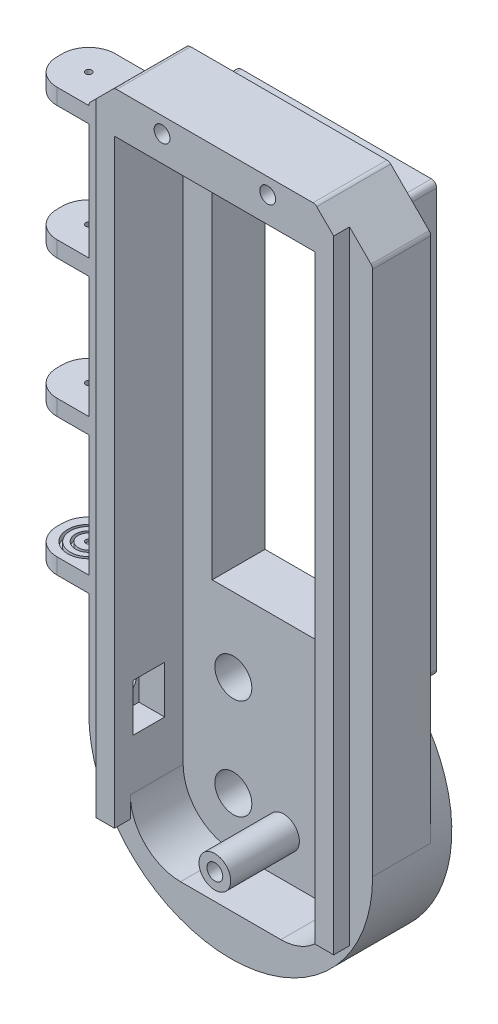
from build123d import *
from build123d.topology import SkipClean

# Parameters (mm, degrees)
CROQUIS1_W               = 27
CROQUIS1_H               = 72
CROQUIS1_R               = 3.5
SALIENTE_EXTRUIR1_DEPTH  = 5
CROQUIS2_W               = 38
CROQUIS2_H               = 81
CROQUIS2_W_2             = 27
CROQUIS2_H_2             = 72
SALIENTE_EXTRUIR2_DEPTH  = 5
SALIENTE_EXTRUIR9_START  = -1
SALIENTE_EXTRUIR9_DEPTH  = 1
SALIENTE_EXTRUIR10_DEPTH = 11
SALIENTE_EXTRUIR11_DEPTH = 10
REDONDEO1_R              = 1
REDONDEO2_R              = 1
REDONDEO3_R              = 1
CROQUIS6_W               = 6
CROQUIS6_H               = 9
CORTAR_EXTRUIR1_DEPTH    = 8
CROQUIS7_W               = 6
CROQUIS7_H               = 9
CROQUIS7_R               = 2.5
SALIENTE_EXTRUIR12_DEPTH = 3
CROQUIS8_W               = 11
CROQUIS8_H               = 3
SALIENTE_EXTRUIR13_DEPTH = 11
REDONDEO4_R              = 5
CROQUIS9_R               = 0.6
CORTAR_EXTRUIR2_DEPTH    = 80
SALIENTE_EXTRUIR14_START = -2.5
CROQUIS10_R              = 0.6
SALIENTE_EXTRUIR14_DEPTH = 2.5
CROQUIS11_R              = 4
CROQUIS11_R_2            = 3.5
CROQUIS11_R_3            = 2.5
CROQUIS11_R_4            = 2
CORTAR_EXTRUIR3_DEPTH    = 1
SALIENTE_EXTRUIR15_DEPTH = 3
CROQUIS14_R              = 1.5
CORTAR_EXTRUIR4_DEPTH    = 14
CROQUIS16_W              = 3.5
CROQUIS16_H              = 3
SALIENTE_EXTRUIR16_DEPTH = 4
SALIENTE_EXTRUIR21_DEPTH = 18
CROQUIS26_R              = 1.5
CORTAR_EXTRUIR7_DEPTH    = 18


with BuildPart() as part:
    # Croquis1 → Saliente-Extruir1 (new body)
    with BuildSketch(Plane.XY):
        with BuildLine():
            Line((-19, 40.5), (-19, -40.5))
            ThreePointArc((-19, -40.5), (0, -86.370057685), (19, -40.5))
            Line((19, -40.5), (19, 40.5))
            Line((19, 40.5), (-19, 40.5))
        make_face()
        Rectangle(CROQUIS1_W, CROQUIS1_H, mode=Mode.SUBTRACT)
        with Locations((9.5, -59.5)):
            Circle(CROQUIS1_R, mode=Mode.SUBTRACT)
        with Locations((-9.5, -69)):
            Circle(CROQUIS1_R, mode=Mode.SUBTRACT)
        with Locations((-9.5, -50)):
            Circle(CROQUIS1_R, mode=Mode.SUBTRACT)
    extrude(amount=SALIENTE_EXTRUIR1_DEPTH)

    # Croquis2 → Saliente-Extruir2 (add)
    with BuildSketch(Plane(origin=(0, 0, 0), x_dir=(-1, 0, 0), z_dir=(0, 0, -1))):
        Rectangle(CROQUIS2_W, CROQUIS2_H)
        Rectangle(CROQUIS2_W_2, CROQUIS2_H_2, mode=Mode.SUBTRACT)
    extrude(amount=SALIENTE_EXTRUIR2_DEPTH)

    # Croquis3 → Saliente-Extruir9 (add)
    with BuildSketch(Plane.XY.offset(5).offset(SALIENTE_EXTRUIR9_START)):
        with BuildLine():
            Line((26.870057685, -59.5), (26.870057685, 40.5))
            Line((26.870057685, 40.5), (19, 48.370057685))
            Line((19, 48.370057685), (-19, 48.370057685))
            Line((-19, 48.370057685), (-26.870057685, 40.5))
            Line((-26.870057685, 40.5), (-26.870057685, -59.5))
            ThreePointArc((-26.870057685, -59.5), (0, -86.370057685), (26.870057685, -59.5))
        make_face()
        with BuildLine():
            Line((19, -59.5), (19, 40.5))
            Line((19, 40.5), (-19, 40.5))
            Line((-19, 40.5), (-19, -59.5))
            ThreePointArc((-19, -59.5), (0, -78.5), (19, -59.5))
        make_face(mode=Mode.SUBTRACT)
    extrude(amount=SALIENTE_EXTRUIR9_DEPTH)

    # Croquis4 → Saliente-Extruir10 (add)
    with BuildSketch(Plane(origin=(0, 0, 4), x_dir=(-1, 0, 0), z_dir=(0, 0, -1))):
        with BuildLine():
            Line((-19, -40.5), (-19, 40.5))
            Line((-19, 40.5), (19, 40.5))
            Line((19, 40.5), (19, -40.5))
            ThreePointArc((19, -40.5), (24.824696333, -49.217274097), (26.870057685, -59.5))
            Line((26.870057685, -59.5), (26.870057685, 40.5))
            Line((26.870057685, 40.5), (19, 48.370057685))
            Line((19, 48.370057685), (-19, 48.370057685))
            Line((-19, 48.370057685), (-26.870057685, 40.5))
            Line((-26.870057685, 40.5), (-26.870057685, -59.5))
            ThreePointArc((-26.870057685, -59.5), (-24.824696333, -49.217274097), (-19, -40.5))
        make_face()
    extrude(amount=-SALIENTE_EXTRUIR10_DEPTH)

    # Croquis5 → Saliente-Extruir11 (add)
    with SkipClean():  # the faces are left unmerged after this step: merging them gives an invalid solid
        with BuildSketch(Plane.XY.offset(5)):
            with BuildLine():
                Line((-19, -59.5), (-19, -69))
                ThreePointArc((-19, -69), (-16.217514421, -75.717514421), (-9.5, -78.5))
                Line((-9.5, -78.5), (9.5, -78.5))
                ThreePointArc((9.5, -78.5), (16.217514421, -75.717514421), (19, -69))
                Line((19, -69), (19, -59.5))
                Line((19, -59.5), (19, -40.5))
                ThreePointArc((19, -40.5), (0, -86.370057685), (-19, -40.5))
                Line((-19, -40.5), (-19, -59.5))
            make_face()
        extrude(amount=SALIENTE_EXTRUIR11_DEPTH)

    # Redondeo1
    redondeo1_edges = [part.edges().sort_by_distance(p)[0] for p in [
        (-19, -40.5, -2.5),
        (-19, 40.5, -0.5),
        (19, 40.5, -0.5),
        (19, -40.5, -2.5),
    ]]
    fillet(redondeo1_edges, radius=REDONDEO1_R)

    # Redondeo2
    redondeo2_edges = [part.edges().sort_by_distance(p)[0] for p in [
        (-18.707106781, 40.207106781, 4),
        (18.707106781, 40.207106781, 4),
        (-19, -0.5, 4),
        (0, 40.5, 4),
        (19, -0.5, 4),
    ]]
    fillet(redondeo2_edges, radius=REDONDEO2_R)

    # Redondeo3
    redondeo3_edges = [part.edges().sort_by_distance(p)[0] for p in [
        (-26.870057685, 40.5, 9.5),
        (-19, 48.370057685, 9.5),
        (26.870057685, 40.5, 9.5),
        (19, 48.370057685, 9.5),
    ]]
    fillet(redondeo3_edges, radius=REDONDEO3_R)

    # Croquis6 → Cortar-Extruir1 (cut)
    with SkipClean():  # the faces are left unmerged after this step: merging them gives an invalid solid
        with BuildSketch(Plane.ZY.offset(26.870057685)):
            with Locations((11.5, -55)):
                Rectangle(CROQUIS6_W, CROQUIS6_H)
        extrude(amount=-CORTAR_EXTRUIR1_DEPTH, mode=Mode.SUBTRACT)

    # Croquis7 → Saliente-Extruir12 (add)
    with SkipClean():  # the faces are left unmerged after this step: merging them gives an invalid solid
        with BuildSketch(Plane.ZY.offset(26.870057685)):
            with Locations((11.5, -55)):
                Rectangle(CROQUIS7_W, CROQUIS7_H)
            with Locations((11.5, -55)):
                Circle(CROQUIS7_R, mode=Mode.SUBTRACT)
        extrude(amount=-SALIENTE_EXTRUIR12_DEPTH)

    # Croquis8 → Saliente-Extruir13 (add)
    with SkipClean():  # the faces are left unmerged after this step: merging them gives an invalid solid
        with BuildSketch(Plane.ZY.offset(26.870057685)):
            with Locations((9.5, 38.585786438)):
                Rectangle(CROQUIS8_W, CROQUIS8_H)
            with Locations((9.5, 13.585786438)):
                Rectangle(CROQUIS8_W, CROQUIS8_H)
            with Locations((9.5, -12.414213562)):
                Rectangle(CROQUIS8_W, CROQUIS8_H)
            with Locations((9.5, -38.414213562)):
                Rectangle(CROQUIS8_W, CROQUIS8_H)
        extrude(amount=SALIENTE_EXTRUIR13_DEPTH)

    # Redondeo4
    redondeo4_edges = [part.edges().sort_by_distance(p)[0] for p in [
        (-37.870057685, -38.414213562, 4),
        (-37.870057685, -38.414213562, 15),
        (-37.870057685, -12.414213562, 4),
        (-37.870057685, -12.414213562, 15),
        (-37.870057685, 13.585786438, 4),
        (-37.870057685, 13.585786438, 15),
        (-37.870057685, 38.585786438, 4),
        (-37.870057685, 38.585786438, 15),
    ]]
    fillet(redondeo4_edges, radius=REDONDEO4_R)

    # Croquis9 → Cortar-Extruir2 (cut)
    with SkipClean():  # the faces are left unmerged after this step: merging them gives an invalid solid
        with BuildSketch(Plane(origin=(0, 40.085786438, 0), x_dir=(1, 0, 0), z_dir=(0, 1, 0))):
            with Locations((-32.370057685, -9.5)):
                Circle(CROQUIS9_R)
        extrude(amount=-CORTAR_EXTRUIR2_DEPTH, mode=Mode.SUBTRACT)

    # Croquis10 → Saliente-Extruir14 (add)
    with SkipClean():  # the faces are left unmerged after this step: merging them gives an invalid solid
        with BuildSketch(Plane.XZ.offset(39.914213562).offset(SALIENTE_EXTRUIR14_START)):
            with Locations((-32.370057685, 9.5)):
                Circle(CROQUIS10_R)
        extrude(amount=SALIENTE_EXTRUIR14_DEPTH)

    # Croquis11 → Cortar-Extruir3 (cut)
    # profile 1 of 2: a face of its own
    with SkipClean():  # the faces are left unmerged after this step: merging them gives an invalid solid
        with BuildSketch(Plane(origin=(0, -36.914213562, 0), x_dir=(1, 0, 0), z_dir=(0, 1, 0))):
            with Locations((-32.370057685, -9.5)):
                Circle(CROQUIS11_R)
            with Locations((-32.370057685, -9.5)):
                Circle(CROQUIS11_R_2, mode=Mode.SUBTRACT)
        # profile 2 of 2: a face of its own
        with BuildSketch(Plane(origin=(0, -36.914213562, 0), x_dir=(1, 0, 0), z_dir=(0, 1, 0))):
            with Locations((-32.370057685, -9.5)):
                Circle(CROQUIS11_R_3)
            with Locations((-32.370057685, -9.5)):
                Circle(CROQUIS11_R_4, mode=Mode.SUBTRACT)
        extrude(amount=-CORTAR_EXTRUIR3_DEPTH, mode=Mode.SUBTRACT)

    # Croquis13 → Saliente-Extruir15 (add)
    with SkipClean():  # the faces are left unmerged after this step: merging them gives an invalid solid
        with BuildSketch(Plane.XY.offset(15)):
            with BuildLine():
                Line((-19, 40.5), (19, 40.5))
                Line((19, 40.5), (19, -69))
                Line((19, -69), (22.5, -69))
                Line((22.5, -69), (22.5, 44.870057685))
                Line((22.5, 44.870057685), (19.292893219, 48.077164466))
                ThreePointArc((19.292893219, 48.077164466), (18.96846987, 48.293937218), (18.585786438, 48.370057685))
                Line((18.585786438, 48.370057685), (-18.585786438, 48.370057685))
                ThreePointArc((-18.585786438, 48.370057685), (-18.96846987, 48.293937218), (-19.292893219, 48.077164466))
                Line((-19.292893219, 48.077164466), (-22.5, 44.870057685))
                Line((-22.5, 44.870057685), (-22.5, -69))
                Line((-22.5, -69), (-19, -69))
                Line((-19, -69), (-19, 40.5))
            make_face()
        extrude(amount=SALIENTE_EXTRUIR15_DEPTH)

    # Croquis14 → Cortar-Extruir4 (cut)
    with SkipClean():  # the faces are left unmerged after this step: merging them gives an invalid solid
        with BuildSketch(Plane(origin=(0, 0, 4), x_dir=(-1, 0, 0), z_dir=(0, 0, -1))):
            with Locations((10, 45.370057685)):
                Circle(CROQUIS14_R)
            with Locations((-10, 45.370057685)):
                Circle(CROQUIS14_R)
        extrude(amount=-CORTAR_EXTRUIR4_DEPTH, mode=Mode.SUBTRACT)

    # Croquis16 → Saliente-Extruir16 (add)
    with SkipClean():  # the faces are left unmerged after this step: merging them gives an invalid solid
        with BuildSketch(Plane(origin=(0, -69, 0), x_dir=(-1, 0, 0), z_dir=(0, -1, 0))):
            with Locations((20.75, -16.5)):
                Rectangle(CROQUIS16_W, CROQUIS16_H)
            with Locations((-20.75, -16.5)):
                Rectangle(CROQUIS16_W, CROQUIS16_H)
        extrude(amount=SALIENTE_EXTRUIR16_DEPTH)

    # Croquis25 → Saliente-Extruir21 (add)
    with SkipClean():  # the faces are left unmerged after this step: merging them gives an invalid solid
        with BuildSketch(Plane.XY.offset(18)):
            with BuildLine():
                ThreePointArc((3, -70.629942315), (2.121320344, -68.508621971), (0, -67.629942315))
                ThreePointArc((0, -67.629942315), (-2.121320344, -72.751262658), (3, -70.629942315))
            make_face()
            with BuildLine():
                ThreePointArc((1.5, -70.629942315), (-1.060660172, -71.690602487), (0, -69.129942315))
                ThreePointArc((0, -69.129942315), (1.060660172, -69.569282143), (1.5, -70.629942315))
            make_face(mode=Mode.SUBTRACT)
        extrude(amount=-SALIENTE_EXTRUIR21_DEPTH)

    # Croquis26 → Cortar-Extruir7 (cut)
    with SkipClean():  # the faces are left unmerged after this step: merging them gives an invalid solid
        with BuildSketch(Plane.XY.offset(18)):
            with Locations((0, -70.629942315)):
                Circle(CROQUIS26_R)
        extrude(amount=-CORTAR_EXTRUIR7_DEPTH, mode=Mode.SUBTRACT)


solid = part.part
